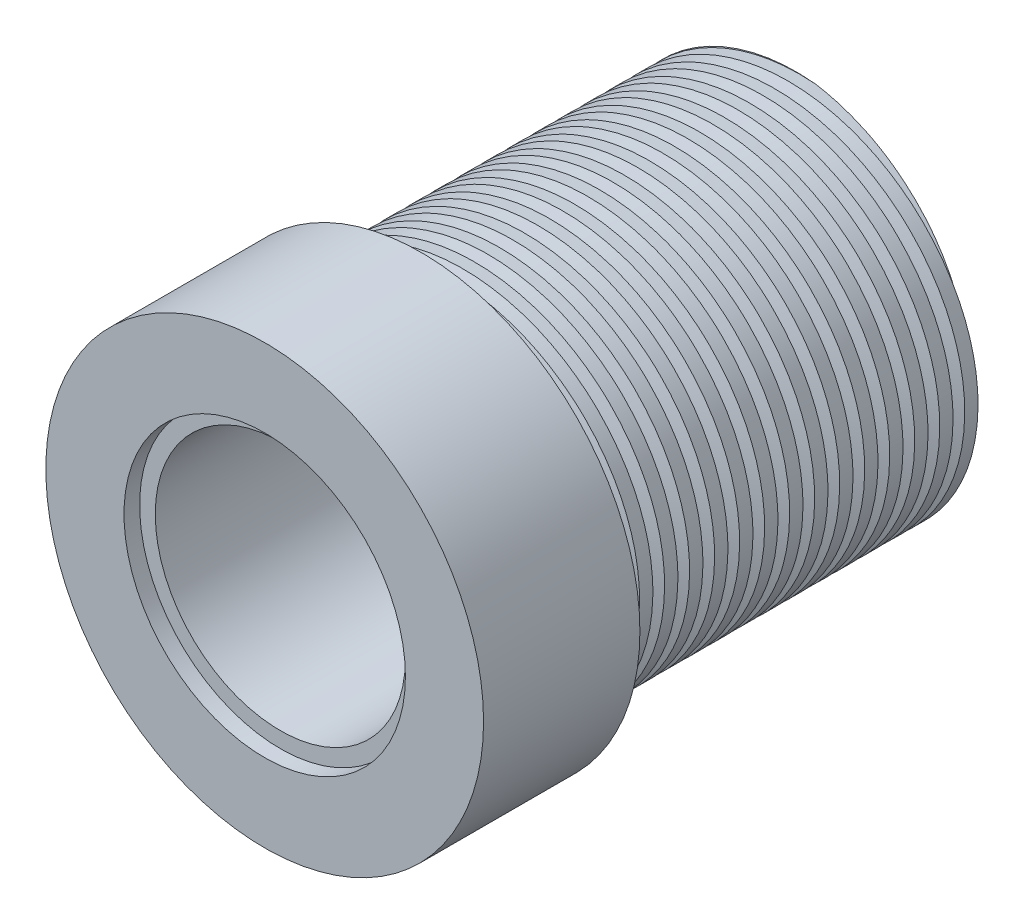
from build123d import *

# Parameters (mm, degrees)
SKETCH1_R           = 6
BOSS_EXTRUDE1_DEPTH = 12
SKETCH2_R           = 7
BOSS_EXTRUDE2_DEPTH = 5
SKETCH3_R           = 4.5
CUT_EXTRUDE1_DEPTH  = 0.5
CUT_SWEEP1_PITCH    = 0.8
SKETCH6_R           = 4
CUT_EXTRUDE2_DEPTH  = 17


with BuildPart() as part:
    # Sketch1 → Boss-Extrude1 (new body)
    with BuildSketch(Plane.XY):
        Circle(SKETCH1_R)
    extrude(amount=BOSS_EXTRUDE1_DEPTH)

    # Sketch2 → Boss-Extrude2 (add)
    with BuildSketch(Plane.XY.offset(12)):
        Circle(SKETCH2_R)
    extrude(amount=BOSS_EXTRUDE2_DEPTH)

    # Sketch3 → Cut-Extrude1 (cut)
    with BuildSketch(Plane.XY.offset(17)):
        Circle(SKETCH3_R)
    extrude(amount=-CUT_EXTRUDE1_DEPTH, mode=Mode.SUBTRACT)

    # Cut-Sweep1: arcs per turn and ends read off the stored shape
    # Cut-Sweep1: the profile of Sketch4 screwed along a right-hand helix through 15.5 turns, 8 arcs to a turn; built about Z, then put on its axis
    cut_sweep1_z = Axis((0, 0, 0), (0, 0, 1))
    cut_sweep1_corners = [(5.5, 0, -0.8), (6.5, 0, -1.175), (6.5, 0, -0.425)]
    with BuildLine(mode=Mode.PRIVATE) as cut_sweep1_profile:
        Line(cut_sweep1_corners[0], cut_sweep1_corners[1])
        Line(cut_sweep1_corners[1], cut_sweep1_corners[2])
        Line(cut_sweep1_corners[2], cut_sweep1_corners[0])
    cut_sweep1_cap = Face(cut_sweep1_profile.wire())
    cut_sweep1_turn_angles = [0, 22.5, 45, 67.5, 90, 112.5, 135, 157.5, 180, 202.5, 225, 247.5, 270, 292.5, 315, 337.5, 360]
    cut_sweep1_turn_weights = [1, 0.9238795325112867, 1, 0.9238795325112867, 1, 0.9238795325112867, 1, 0.9238795325112867, 1, 0.9238795325112867, 1, 0.9238795325112867, 1, 0.9238795325112867, 1, 0.9238795325112867, 1]
    cut_sweep1_turn_rails = [Edge.make_bspline([Vector(p[0], p[1], 0).rotate(cut_sweep1_z, cut_sweep1_turn_angles[k]) / cut_sweep1_turn_weights[k] + Vector(0, 0, p[2] + CUT_SWEEP1_PITCH * cut_sweep1_turn_angles[k] / 360) for k in range(17)], [0, 0, 0, 1, 1, 2, 2, 3, 3, 4, 4, 5, 5, 6, 6, 7, 7, 8, 8, 8], 2, cut_sweep1_turn_weights) for p in cut_sweep1_corners]
    cut_sweep1_turn_sides = [Face.make_surface_from_curves(cut_sweep1_turn_rails[p[0]], cut_sweep1_turn_rails[p[1]]) for p in [(0, 1), (1, 2), (2, 0)]]
    cut_sweep1_last_angles = [5400, 5422.5, 5445, 5467.5, 5490, 5512.5, 5535, 5557.5, 5580]
    cut_sweep1_last_weights = [1, 0.9238795325112867, 1, 0.9238795325112867, 1, 0.9238795325112867, 1, 0.9238795325112867, 1]
    cut_sweep1_last_rails = [Edge.make_bspline([Vector(p[0], p[1], 0).rotate(cut_sweep1_z, cut_sweep1_last_angles[k]) / cut_sweep1_last_weights[k] + Vector(0, 0, p[2] + CUT_SWEEP1_PITCH * cut_sweep1_last_angles[k] / 360) for k in range(9)], [0, 0, 0, 1, 1, 2, 2, 3, 3, 4, 4, 4], 2, cut_sweep1_last_weights) for p in cut_sweep1_corners]
    cut_sweep1_last_sides = [Face.make_surface_from_curves(cut_sweep1_last_rails[p[0]], cut_sweep1_last_rails[p[1]]) for p in [(0, 1), (1, 2), (2, 0)]]
    cut_sweep1 = Plane(origin=(0, 0, 0), x_dir=(1, 0, 0), z_dir=(0, 0, 1)) * Solid(Shell([*[p.moved(Location((0, 0, CUT_SWEEP1_PITCH * i))) for i in range(15) for p in cut_sweep1_turn_sides], *cut_sweep1_last_sides, cut_sweep1_cap, cut_sweep1_cap.rotate(cut_sweep1_z, 5580).moved(Location((0, 0, CUT_SWEEP1_PITCH * 5580 / 360)))]))
    add(cut_sweep1, mode=Mode.SUBTRACT)

    # Sketch6 → Cut-Extrude2 (cut)
    with BuildSketch(Plane.XY.offset(16.5)):
        Circle(SKETCH6_R)
    extrude(amount=-CUT_EXTRUDE2_DEPTH, mode=Mode.SUBTRACT)


solid = part.part
